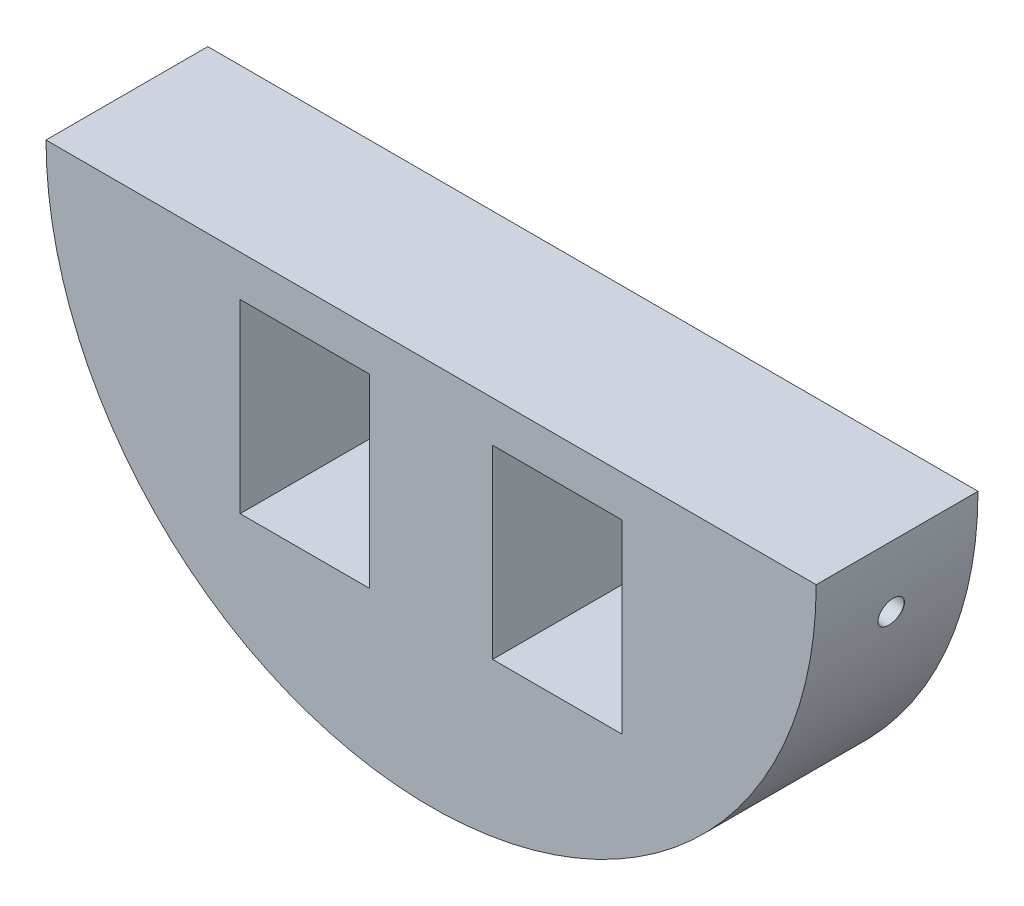
from build123d import *
from OCP.BRepFilletAPI import BRepFilletAPI_MakeChamfer

# Parameters (mm, degrees)
SKETCH1_W           = 20
SKETCH1_H           = 20
BOSS_EXTRUDE1_DEPTH = 25
CIRPATTERN1_COUNT   = 5
CIRPATTERN1_ANGLE   = 160
CHAMFER1_SIZE       = 15
CHAMFER1_SIZE2      = 8.660254038


with BuildPart() as part:
    # Sketch1 → Boss-Extrude1 (new body)
    with BuildSketch(Plane.XY):
        with BuildLine():
            Line((-119, 0), (0, 0))
            ThreePointArc((0, 0), (-59.5, -59.5), (-119, 0))
        make_face()
        with Locations((-40, -25)):
            Rectangle(SKETCH1_W, SKETCH1_H, mode=Mode.SUBTRACT)
        with Locations((-79, -25)):
            Rectangle(SKETCH1_W, SKETCH1_H, mode=Mode.SUBTRACT)
    extrude(amount=BOSS_EXTRUDE1_DEPTH)

    # Sketch4 → Ø4.0mm Dowel Hole2 (revolve, cut)
    with BuildSketch(Plane(origin=(-0.903938696, -10.332066571, 12.5), x_dir=(0.1736481776669305, 0.9848077530122081, 0), z_dir=(0, 0, 1))):
        Polygon((0, 0), (0, 11.201721238), (2, 10), (2, 0.025), (2.025, 0), align=None)
    f_4_0mm_dowel_hole2 = revolve(axis=Axis((5.349590536, -11.434732499, 12.5), (-0.9848077530122081, 0.1736481776669305, 0)), mode=Mode.SUBTRACT)

    # CirPattern1: Ø4.0mm Dowel Hole2 ×5 about axis
    cirpattern1_axis = Axis((-59.5, 0, 0), (0, 0, -1))
    for i in range(1, CIRPATTERN1_COUNT):
        add(f_4_0mm_dowel_hole2.rotate(cirpattern1_axis, i * CIRPATTERN1_ANGLE / (CIRPATTERN1_COUNT - 1)), mode=Mode.SUBTRACT)

    # Chamfer1: one chamfer whose edges measure the first distance from different faces: ONE call of the kernel's chamfer builder (chamfer() names one face for all edges)
    chamfer1_edges_1 = [part.edges().sort_by_distance(p)[0] for p in [
        (-79, -15, 25),
    ]]
    chamfer1_side_1 = [part.faces().sort_by_distance(p)[0] for p in [
        (-79, -15, 12.5),
    ]]
    chamfer1_edges_2 = [part.edges().sort_by_distance(p)[0] for p in [
        (-40, -15, 25),
    ]]
    chamfer1_side_2 = [part.faces().sort_by_distance(p)[0] for p in [
        (-40, -15, 12.5),
    ]]
    chamfer1 = BRepFilletAPI_MakeChamfer(part.part.solid().wrapped)
    for e in chamfer1_edges_1:
        chamfer1.Add(CHAMFER1_SIZE, CHAMFER1_SIZE2, e.wrapped, chamfer1_side_1[0].wrapped)  # the first distance lies on this face
    for e in chamfer1_edges_2:
        chamfer1.Add(CHAMFER1_SIZE, CHAMFER1_SIZE2, e.wrapped, chamfer1_side_2[0].wrapped)  # the first distance lies on this face
    add(Compound.cast(chamfer1.Shape()), mode=Mode.REPLACE)


solid = part.part
